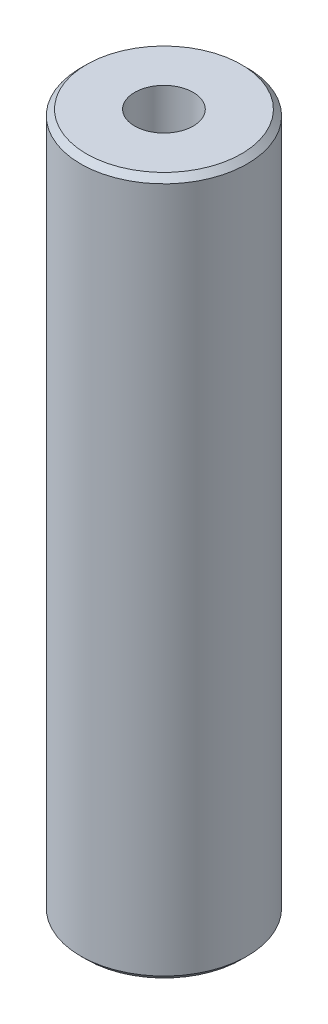
from build123d import *

# Parameters (mm, degrees)
SKETCH1_R           = 55
BOSS_EXTRUDE1_DEPTH = 461.053021341
SKETCH2_R           = 19.332226736
CUT_EXTRUDE1_DEPTH  = 468.5680576
CHAMFER1_SIZE       = 3.835971903


with BuildPart() as part:
    # Sketch1 → Boss-Extrude1 (new body)
    with BuildSketch(Plane(origin=(0, 0, 0), x_dir=(1, 0, 0), z_dir=(0, 1, 0))):
        Circle(SKETCH1_R)
    extrude(amount=BOSS_EXTRUDE1_DEPTH)

    # Sketch2 → Cut-Extrude1 (cut, through all)
    with BuildSketch(Plane(origin=(0, 0, 0), x_dir=(1, 0, 0), z_dir=(0, 1, 0))):
        Circle(SKETCH2_R)
    extrude(amount=CUT_EXTRUDE1_DEPTH, mode=Mode.SUBTRACT)

    # Chamfer1
    chamfer1_edges = [part.edges().sort_by_distance(p)[0] for p in [
        (-55, 461.053021341, 0),
        (-55, 0, 0),
    ]]
    chamfer(chamfer1_edges, length=CHAMFER1_SIZE)


solid = part.part
